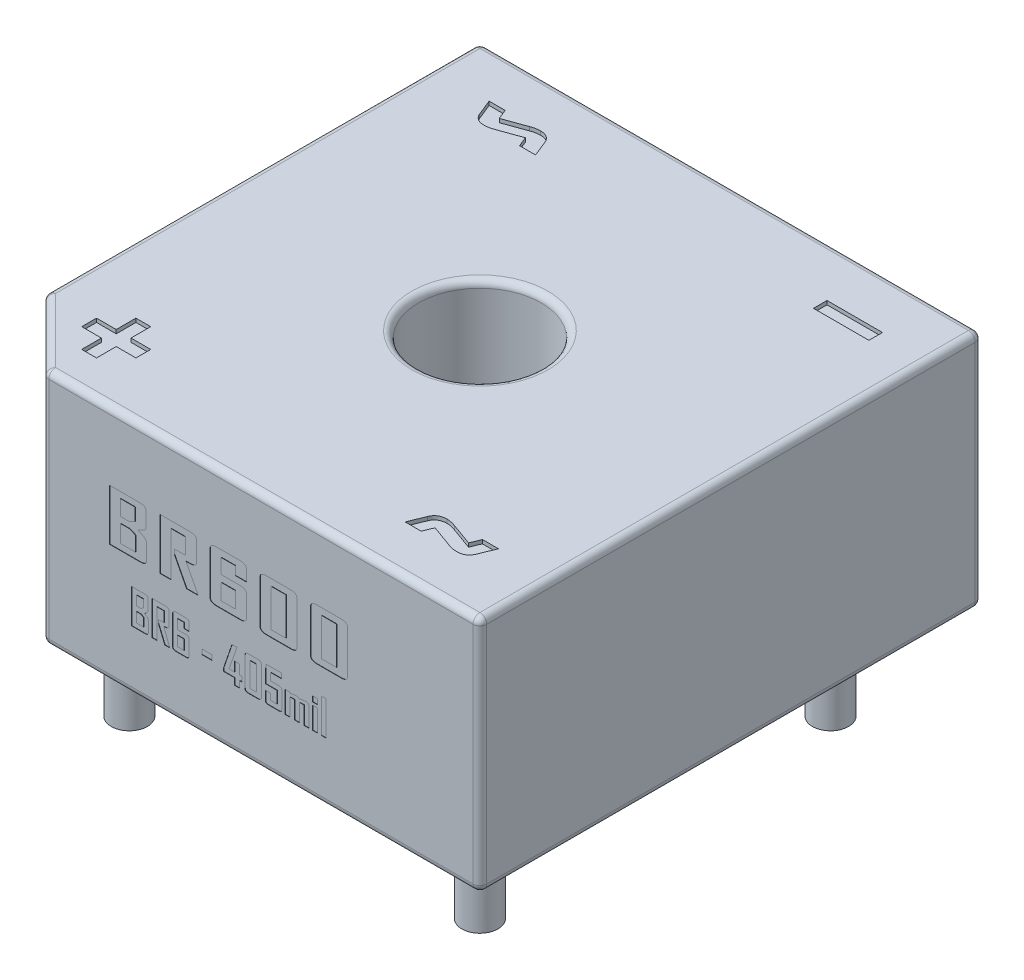
from build123d import *

# Parameters (mm, degrees)
BODY_SKETCH_W          = 14.732
BODY_SKETCH_H          = 14.732
BODY_SKETCH_R          = 1.8
BODY_MAIN_DEPTH        = 7
BODY_CHAMFER_SIZE      = 2
SKETCH24_R             = 2.3
BODY_CUT_DEPTH         = 2
BODY_REVOLVE_CUT_REACH = 22.574
BODY_FILLET_R          = 0.2
PIN_B1_SKETCH_R        = 0.53
CIRPATTERN1_COUNT      = 4
TEXT_START             = 2.2125
TEXT_2_OUTLINE_W       = 0.192771085
TEXT_2_OUTLINE_H       = 0.710843374
TEXT_2_OUTLINE_W_2     = 0.192771084
TEXT_2_OUTLINE_H_2     = 0.289156627
TEXT_2_OUTLINE_W_3     = 0.43373494
TEXT_2_OUTLINE_H_3     = 1.102409638
TEXT_2_OUTLINE_W_4     = 0.41566265
TEXT_2_OUTLINE_H_4     = 0.469879518
TEXT_2_OUTLINE_W_5     = 0.144578314
TEXT_2_OUTLINE_H_5     = 1
TEXT_2_OUTLINE_H_6     = 0.638554217
TEXT_2_OUTLINE_W_6     = 0.147213856
TEXT_2_OUTLINE_H_7     = 0.156626506
TEXT_2_OUTLINE_W_7     = 0.301204819
TEXT_2_OUTLINE_H_8     = 0.144578314
TEXT_2_DEPTH           = 0.01
SKETCH23_W             = 1.626506024
SKETCH23_H             = 0.397590361
TEXT1_DEPTH            = 0.11
PIN1_MARK_DEPTH        = 0.04


# Read off the part's stored shape, not the designer's step: text
with BuildPart() as part:
    # BODY_Sketch → BODY_MAIN (new body)
    with BuildSketch(Plane(origin=(0, 0.1, 0), x_dir=(1, 0, 0), z_dir=(0, 1, 0))):
        with Locations((5.1435, 5.1435)):
            Rectangle(BODY_SKETCH_W, BODY_SKETCH_H)
        with Locations(Location((5.1435, 5.1435, 0), (0, 0, 270))):
            Circle(BODY_SKETCH_R, mode=Mode.SUBTRACT)
    extrude(amount=BODY_MAIN_DEPTH)

    # BODY_Chamfer
    body_chamfer_edges = [part.edges().sort_by_distance(p)[0] for p in [
        (-2.2225, 3.6, 2.2225),
    ]]
    chamfer(body_chamfer_edges, length=BODY_CHAMFER_SIZE)

    # Sketch24 → BODY_Cut (cut)
    with BuildSketch(Plane(origin=(0, 0.1, 0), x_dir=(1, 0, 0), z_dir=(0, 1, 0))):
        Polygon((0.191713562, -1.2225), (11.5095, -1.2225), (11.5095, 11.5095), (-1.2225, 11.5095), (-1.2225, 0.191713562), align=None)
        with Locations(Location((5.1435, 5.1435, 0), (0, 0, 270))):
            Circle(SKETCH24_R, mode=Mode.SUBTRACT)
    extrude(amount=BODY_CUT_DEPTH, mode=Mode.SUBTRACT)

    # Sketch26 → BODY_Revolve (revolve)
    with BuildSketch(Plane(origin=(0, 0, 0), x_dir=(0, -1, 0), z_dir=(0.7071067811865461, 0, 0.707106781186549)), mode=Mode.PRIVATE) as body_revolve_sk:
        with BuildLine():
            Line((-0.4, 16.276890996), (-2.3, 16.276890996))
            Line((-2.3, 16.276890996), (-2.3, 9.574007458))
            Line((-2.3, 9.574007458), (-0.4, 9.574007458))
            add(Edge.make_bspline(
                [(-0.4, 16.276890996), (-0.4, 15.845624491), (-0.844458704, 12.99011115), (-3.607181086, 10.231780015), (-0.4, 9.574007458)],
                knots=[0, 0, 0, 0, 0.210970547, 1, 1, 1, 1], degree=3))
        make_face()
    revolve(body_revolve_sk.sketch.rotate(Axis((5.1435, 11.249169558, -5.1435), (0, -1, 0)), 135), axis=Axis((5.1435, 11.249169558, -5.1435), (0, -1, 0)))

    # Sketch28 → BODY_Revolve_Cut (cut, up to next)
    with BuildSketch(Plane(origin=(0, 2.3, 0), x_dir=(1, 0, 0), z_dir=(0, 1, 0)), mode=Mode.PRIVATE) as body_revolve_cut_sk1:
        with BuildLine():
            Line((-2.2225, -0.032787859), (-2.2225, 10.319787859))
            ThreePointArc((-2.2225, 10.319787859), (-3.859383538, 5.1435), (-2.2225, -0.032787859))
        make_face()
    body_revolve_cut_tool1 = extrude(body_revolve_cut_sk1.sketch, amount=-BODY_REVOLVE_CUT_REACH, mode=Mode.PRIVATE) & part.part
    # Sketch28 → BODY_Revolve_Cut (cut, up to next)
    with BuildSketch(Plane(origin=(0, 2.3, 0), x_dir=(1, 0, 0), z_dir=(0, 1, 0)), mode=Mode.PRIVATE) as body_revolve_cut_sk2:
        with BuildLine():
            Line((12.5095, 10.319787859), (12.5095, -0.032787859))
            ThreePointArc((12.5095, -0.032787859), (14.146383538, 5.1435), (12.5095, 10.319787859))
        make_face()
    body_revolve_cut_tool2 = extrude(body_revolve_cut_sk2.sketch, amount=-BODY_REVOLVE_CUT_REACH, mode=Mode.PRIVATE) & part.part
    # Sketch28 → BODY_Revolve_Cut (cut, up to next)
    with BuildSketch(Plane(origin=(0, 2.3, 0), x_dir=(1, 0, 0), z_dir=(0, 1, 0)), mode=Mode.PRIVATE) as body_revolve_cut_sk3:
        with BuildLine():
            Line((10.319787859, -2.2225), (-0.032787859, -2.2225))
            ThreePointArc((-0.032787859, -2.2225), (5.1435, -3.859383538), (10.319787859, -2.2225))
        make_face()
    body_revolve_cut_tool3 = extrude(body_revolve_cut_sk3.sketch, amount=-BODY_REVOLVE_CUT_REACH, mode=Mode.PRIVATE) & part.part
    # Sketch28 → BODY_Revolve_Cut (cut, up to next)
    with BuildSketch(Plane(origin=(0, 2.3, 0), x_dir=(1, 0, 0), z_dir=(0, 1, 0)), mode=Mode.PRIVATE) as body_revolve_cut_sk4:
        with BuildLine():
            ThreePointArc((10.319787859, 12.5095), (5.1435, 14.146383538), (-0.032787859, 12.5095))
            Line((-0.032787859, 12.5095), (10.319787859, 12.5095))
        make_face()
    body_revolve_cut_tool4 = extrude(body_revolve_cut_sk4.sketch, amount=-BODY_REVOLVE_CUT_REACH, mode=Mode.PRIVATE) & part.part
    add(body_revolve_cut_tool1.solids().sort_by_distance((-2.882639, 2.3, -5.1435))[0], mode=Mode.SUBTRACT)
    add(body_revolve_cut_tool2.solids().sort_by_distance((13.169639, 2.3, -5.1435))[0], mode=Mode.SUBTRACT)
    add(body_revolve_cut_tool3.solids().sort_by_distance((5.1435, 2.3, 2.882639))[0], mode=Mode.SUBTRACT)
    add(body_revolve_cut_tool4.solids().sort_by_distance((5.1435, 2.3, -13.169639))[0], mode=Mode.SUBTRACT)

    # BODY_Fillet
    body_fillet_edges = [part.edges().sort_by_distance(p)[0] for p in [
        (5.1435, 7.1, -6.9435),
        (12.5095, 7.1, -5.1435),
        (5.1435, 7.1, -12.5095),
        (6.1435, 0.1, 2.2225),
        (6.1435, 7.1, 2.2225),
        (-0.2225, 3.6, 2.2225),
        (-1.2225, 0.1, 1.2225),
        (-2.2225, 3.6, 0.2225),
        (-1.2225, 7.1, 1.2225),
        (-2.2225, 7.1, -6.1435),
        (5.1435, 0.1, -12.5095),
        (12.5095, 0.1, -5.1435),
        (-2.2225, 0.1, -6.1435),
        (-2.2225, 3.6, -12.5095),
        (12.5095, 3.6, -12.5095),
        (12.5095, 3.6, 2.2225),
    ]]
    fillet(body_fillet_edges, radius=BODY_FILLET_R)

    # PIN_Sweep: sweep along a path in PIN_B1_Path
    with BuildLine(Plane(origin=(0, 0, 0), x_dir=(0, 0, -1), z_dir=(1, 0, 0))) as pin_sweep_path:
        Line((0, -2.7), (0, 0))
        Line((0, 0), (0, 3.6))
    # PIN_B1_Sketch → PIN_Sweep (sweep)
    with BuildSketch(Plane(origin=(0, 0, 0), x_dir=(1, 0, 0), z_dir=(0, 1, 0))):
        Circle(PIN_B1_SKETCH_R)
    pin_sweep = sweep(path=pin_sweep_path.line)

    # CirPattern1: PIN_Sweep ×4 about axis
    cirpattern1_axis = Axis((5.1435, 0, -5.1435), (0, 1, 0))
    for i in range(1, CIRPATTERN1_COUNT):
        add(pin_sweep.rotate(cirpattern1_axis, i * 360 / CIRPATTERN1_COUNT))

    # text 2 outline → text 2 (cut)
    # profile 1 of 16: a face of its own
    with BuildSketch(Plane.XY.offset(TEXT_START)):
        with BuildLine():
            add(Edge.make_bspline(
                [(2.72723494, 3.718317018), (2.726470148, 3.709278365), (2.725003278, 3.691942231), (2.715388648, 3.667990262), (2.701081403, 3.647239819), (2.680680404, 3.630744985), (2.655657104, 3.617265222), (2.625226844, 3.60805875), (2.589862782, 3.601839387), (2.564520572, 3.600639002), (2.55103012, 3.6)],
                knots=[0, 0, 0, 0, 0.114098337, 0.218840581, 0.322174175, 0.429434412, 0.547100708, 0.679564678, 0.829422238, 1, 1, 1, 1], degree=3))
            Line((2.72723494, 3.718317018), (2.72723494, 4.155440512))
            add(Edge.make_bspline(
                [(2.652404367, 4.292394578), (2.658354922, 4.288208998), (2.670030613, 4.279996395), (2.68518465, 4.265533806), (2.698190252, 4.250008652), (2.708884691, 4.233448906), (2.717356401, 4.215645952), (2.722740452, 4.19652504), (2.726727845, 4.176406256), (2.727063684, 4.162521049), (2.72723494, 4.155440512)],
                knots=[0, 0, 0, 0, 0.133657493, 0.26225178, 0.383948145, 0.505447312, 0.623949121, 0.745003415, 0.869968602, 1, 1, 1, 1], degree=3))
            add(Edge.make_bspline(
                [(2.477329066, 4.377108434), (2.490323612, 4.371000971), (2.514635185, 4.359574485), (2.548588493, 4.343423057), (2.577662056, 4.329562103), (2.602028401, 4.318060985), (2.621469501, 4.308458496), (2.63611909, 4.301058465), (2.646046071, 4.296218917), (2.650813002, 4.293351741), (2.652404367, 4.292394578)],
                knots=[0, 0, 0, 0, 0.221438922, 0.414291367, 0.579869792, 0.718174277, 0.829838972, 0.91423528, 0.971368777, 1, 1, 1, 1], degree=3))
            add(Edge.make_bspline(
                [(2.646474398, 4.458433735), (2.644882566, 4.457477586), (2.6402947, 4.454721841), (2.630820988, 4.45001016), (2.616568319, 4.443328397), (2.597946785, 4.433865854), (2.574187222, 4.42304747), (2.546192819, 4.409368019), (2.513337628, 4.39384559), (2.489854385, 4.382930333), (2.477329066, 4.377108434)],
                knots=[0, 0, 0, 0, 0.029670315, 0.085513729, 0.168947239, 0.28130074, 0.41925825, 0.586125272, 0.779250554, 1, 1, 1, 1], degree=3))
            add(Edge.make_bspline(
                [(2.715939759, 4.589175452), (2.715703402, 4.582295185), (2.715244348, 4.568932312), (2.7122336, 4.5494097), (2.706420349, 4.531271222), (2.698783838, 4.51419458), (2.689107271, 4.498185101), (2.677179937, 4.483429042), (2.662877863, 4.469996723), (2.652034082, 4.46235282), (2.646474398, 4.458433735)],
                knots=[0, 0, 0, 0, 0.133406508, 0.259102454, 0.381455931, 0.501515548, 0.621060989, 0.743032877, 0.868251092, 1, 1, 1, 1], degree=3))
            Line((2.715939759, 4.589175452), (2.715939759, 4.981682982))
            add(Edge.make_bspline(
                [(2.54538253, 5.1), (2.558404061, 5.099360983), (2.582907274, 5.098158516), (2.617135866, 5.09190675), (2.646670764, 5.082759111), (2.670874939, 5.069164858), (2.690697134, 5.05273941), (2.704366518, 5.031895781), (2.71365419, 5.008010235), (2.715155488, 4.990716923), (2.715939759, 4.981682982)],
                knots=[0, 0, 0, 0, 0.168128508, 0.316375143, 0.448176834, 0.565139626, 0.672821552, 0.776962353, 0.883486227, 1, 1, 1, 1], degree=3))
            Line((2.54538253, 5.1), (1.64289759, 5.1))
            Line((1.64289759, 5.1), (1.64289759, 3.6))
            Line((1.64289759, 3.6), (2.55103012, 3.6))
        make_face()
        Polygon((1.968198795, 3.780722892), (1.968198795, 4.286746988), (2.235894578, 4.286746988), (2.401933735, 4.213045934), (2.401933735, 3.780722892), align=None, mode=Mode.SUBTRACT)
        Polygon((2.390638554, 4.546253765), (2.230246988, 4.46746988), (1.968198795, 4.46746988), (1.968198795, 4.919277108), (2.390638554, 4.919277108), align=None, mode=Mode.SUBTRACT)
    # profile 2 of 16: a face of its own
    with BuildSketch(Plane.XY.offset(TEXT_START)):
        with BuildLine():
            add(Edge.make_bspline(
                [(6.938680723, 2.455421687), (6.954682956, 2.458932438), (6.986627561, 2.465940808), (7.018563473, 2.472988688), (7.034501506, 2.476506024)],
                knots=[0, 0, 0, 0, 0.500936953, 1, 1, 1, 1], degree=3))
            Line((6.938680723, 2.455421687), (6.938680723, 2.488554217))
            Line((6.938680723, 2.488554217), (6.79410241, 2.488554217))
            Line((6.79410241, 2.488554217), (6.79410241, 1.85))
            Line((6.79410241, 1.85), (6.938680723, 1.85))
            Line((6.938680723, 1.85), (6.938680723, 2.366566265))
            Line((6.938680723, 2.366566265), (7.071210843, 2.368072289))
            Line((7.071210843, 2.368072289), (7.071210843, 1.85))
            Line((7.071210843, 1.85), (7.215789157, 1.85))
            Line((7.215789157, 1.85), (7.215789157, 2.366566265))
            Line((7.215789157, 2.366566265), (7.348319277, 2.368072289))
            Line((7.348319277, 2.368072289), (7.348319277, 1.85))
            Line((7.348319277, 1.85), (7.49289759, 1.85))
            Line((7.49289759, 1.85), (7.49289759, 2.409676205))
            add(Edge.make_bspline(
                [(7.408560241, 2.488554217), (7.415044869, 2.488253553), (7.427330408, 2.487683926), (7.444515429, 2.483781632), (7.459168508, 2.477318334), (7.471370506, 2.468570007), (7.480956268, 2.457203183), (7.487703468, 2.443369843), (7.491845126, 2.427224643), (7.492534742, 2.415726215), (7.49289759, 2.409676205)],
                knots=[0, 0, 0, 0, 0.148290832, 0.280946377, 0.400455298, 0.512425211, 0.621411208, 0.736958176, 0.861597969, 1, 1, 1, 1], degree=3))
            add(Edge.make_bspline(
                [(7.304832831, 2.474246988), (7.315424593, 2.476389603), (7.335299693, 2.48041015), (7.363228016, 2.48496172), (7.387229596, 2.487819783), (7.401902803, 2.488324995), (7.408560241, 2.488554217)],
                knots=[0, 0, 0, 0, 0.309141697, 0.580094407, 0.809483008, 1, 1, 1, 1], degree=3))
            add(Edge.make_bspline(
                [(7.202423193, 2.452786145), (7.219497755, 2.45627019), (7.2536721, 2.463243426), (7.287770866, 2.47057733), (7.304832831, 2.474246988)],
                knots=[0, 0, 0, 0, 0.499630991, 1, 1, 1, 1], degree=3))
            add(Edge.make_bspline(
                [(7.131451807, 2.488554217), (7.135851093, 2.488459163), (7.144246265, 2.488277772), (7.156236574, 2.486549379), (7.167029587, 2.483828311), (7.176537454, 2.479777842), (7.185069157, 2.474920693), (7.192169978, 2.468630731), (7.198313113, 2.461367551), (7.201035395, 2.455683717), (7.202423193, 2.452786145)],
                knots=[0, 0, 0, 0, 0.156270314, 0.29821119, 0.429671568, 0.550627586, 0.664617534, 0.776870433, 0.88625033, 1, 1, 1, 1], degree=3))
            add(Edge.make_bspline(
                [(7.034501506, 2.476506024), (7.043774214, 2.478346616), (7.061509319, 2.481866955), (7.087017071, 2.485578016), (7.110068148, 2.4880487), (7.124606651, 2.488392395), (7.131451807, 2.488554217)],
                knots=[0, 0, 0, 0, 0.289803378, 0.554281819, 0.790142707, 1, 1, 1, 1], degree=3))
        make_face()
    # profile 3 of 16: a face of its own
    with BuildSketch(Plane.XY.offset(TEXT_START)):
        with BuildLine():
            add(Edge.make_bspline(
                [(6.697716867, 1.928878012), (6.69729157, 1.922885605), (6.696488279, 1.911567306), (6.692226108, 1.895788213), (6.685972183, 1.882065602), (6.676752164, 1.870964704), (6.665651266, 1.861744684), (6.651928655, 1.855490759), (6.636149562, 1.851228589), (6.624831263, 1.850425298), (6.618838855, 1.85)],
                knots=[0, 0, 0, 0, 0.143087679, 0.270260174, 0.38817721, 0.5, 0.61182279, 0.729739826, 0.856912321, 1, 1, 1, 1], degree=3))
            Line((6.697716867, 1.928878012), (6.697716867, 2.409676205))
            add(Edge.make_bspline(
                [(6.618838855, 2.488554217), (6.624831263, 2.488128919), (6.636149562, 2.487325628), (6.651928655, 2.483063458), (6.665651266, 2.476809533), (6.676752164, 2.467589513), (6.685972183, 2.456488615), (6.692226108, 2.442766004), (6.696488279, 2.426986911), (6.69729157, 2.415668612), (6.697716867, 2.409676205)],
                knots=[0, 0, 0, 0, 0.143087679, 0.270260174, 0.38817721, 0.5, 0.61182279, 0.729739826, 0.856912321, 1, 1, 1, 1], degree=3))
            Line((6.618838855, 2.488554217), (6.36036747, 2.488554217))
            Line((6.36036747, 2.488554217), (6.372415663, 2.705421687))
            Line((6.372415663, 2.705421687), (6.685668675, 2.705421687))
            Line((6.685668675, 2.705421687), (6.685668675, 2.85))
            Line((6.685668675, 2.85), (6.227837349, 2.85))
            Line((6.227837349, 2.85), (6.215789157, 2.343975904))
            Line((6.215789157, 2.343975904), (6.553138554, 2.343975904))
            Line((6.553138554, 2.343975904), (6.553138554, 1.994578313))
            Line((6.553138554, 1.994578313), (6.36036747, 1.994578313))
            Line((6.36036747, 1.994578313), (6.36036747, 2.175301205))
            Line((6.36036747, 2.175301205), (6.215789157, 2.175301205))
            Line((6.215789157, 2.175301205), (6.215789157, 1.928878012))
            add(Edge.make_bspline(
                [(6.294667169, 1.85), (6.288674761, 1.850425298), (6.277356463, 1.851228589), (6.261577369, 1.855490759), (6.247854758, 1.861744684), (6.23675386, 1.870964704), (6.227533841, 1.882065602), (6.221279916, 1.895788213), (6.217017746, 1.911567306), (6.216214454, 1.922885605), (6.215789157, 1.928878012)],
                knots=[0, 0, 0, 0, 0.143087679, 0.270260174, 0.38817721, 0.5, 0.61182279, 0.729739826, 0.856912321, 1, 1, 1, 1], degree=3))
            Line((6.294667169, 1.85), (6.618838855, 1.85))
        make_face()
    # profile 4 of 16: a face of its own
    with BuildSketch(Plane.XY.offset(TEXT_START)):
        with BuildLine():
            add(Edge.make_bspline(
                [(6.095307229, 1.928878012), (6.094881931, 1.922885605), (6.09407864, 1.911567306), (6.08981647, 1.895788213), (6.083562545, 1.882065602), (6.074342525, 1.870964704), (6.063241627, 1.861744684), (6.049519016, 1.855490759), (6.033739923, 1.851228589), (6.022421624, 1.850425298), (6.016429217, 1.85)],
                knots=[0, 0, 0, 0, 0.143087679, 0.270260174, 0.38817721, 0.5, 0.61182279, 0.729739826, 0.856912321, 1, 1, 1, 1], degree=3))
            Line((6.095307229, 1.928878012), (6.095307229, 2.771121988))
            add(Edge.make_bspline(
                [(6.016429217, 2.85), (6.022421624, 2.849574702), (6.033739923, 2.848771411), (6.049519016, 2.844509241), (6.063241627, 2.838255316), (6.074342525, 2.829035296), (6.083562545, 2.817934398), (6.08981647, 2.804211787), (6.09407864, 2.788432694), (6.094881931, 2.777114395), (6.095307229, 2.771121988)],
                knots=[0, 0, 0, 0, 0.143087679, 0.270260174, 0.38817721, 0.5, 0.61182279, 0.729739826, 0.856912321, 1, 1, 1, 1], degree=3))
            Line((6.016429217, 2.85), (5.694328313, 2.85))
            add(Edge.make_bspline(
                [(5.613379518, 2.771121988), (5.613787826, 2.777117466), (5.614560159, 2.788458173), (5.619054479, 2.804240236), (5.625534839, 2.817876024), (5.63472964, 2.829169706), (5.646243825, 2.838241146), (5.660356017, 2.844549964), (5.676593339, 2.848741356), (5.688213631, 2.849566044), (5.694328313, 2.85)],
                knots=[0, 0, 0, 0, 0.141191735, 0.267070268, 0.384070853, 0.494411966, 0.607065164, 0.726092805, 0.855868051, 1, 1, 1, 1], degree=3))
            Line((5.613379518, 2.771121988), (5.613379518, 1.928878012))
            add(Edge.make_bspline(
                [(5.69225753, 1.85), (5.686265123, 1.850425298), (5.674946824, 1.851228589), (5.659167731, 1.855490759), (5.64544512, 1.861744684), (5.634344222, 1.870964704), (5.625124202, 1.882065602), (5.618870277, 1.895788213), (5.614608107, 1.911567306), (5.613804816, 1.922885605), (5.613379518, 1.928878012)],
                knots=[0, 0, 0, 0, 0.143087679, 0.270260174, 0.38817721, 0.5, 0.61182279, 0.729739826, 0.856912321, 1, 1, 1, 1], degree=3))
            Line((5.69225753, 1.85), (6.016429217, 1.85))
        make_face()
        with Locations((5.854343374, 2.35)):
            Rectangle(TEXT_2_OUTLINE_W, TEXT_2_OUTLINE_H, mode=Mode.SUBTRACT)
    # profile 5 of 16: a face of its own
    with BuildSketch(Plane.XY.offset(TEXT_START)):
        with BuildLine():
            add(Edge.make_bspline(
                [(3.974825301, 1.928878012), (3.974400003, 1.922885605), (3.973596712, 1.911567306), (3.969334542, 1.895788213), (3.963080617, 1.882065602), (3.953860597, 1.870964704), (3.942759699, 1.861744684), (3.929037088, 1.855490759), (3.913257995, 1.851228589), (3.901939697, 1.850425298), (3.895947289, 1.85)],
                knots=[0, 0, 0, 0, 0.143087679, 0.270260174, 0.38817721, 0.5, 0.61182279, 0.729739826, 0.856912321, 1, 1, 1, 1], degree=3))
            Line((3.974825301, 1.928878012), (3.974825301, 2.349435241))
            add(Edge.make_bspline(
                [(3.895947289, 2.428313253), (3.901939697, 2.427887955), (3.913257995, 2.427084664), (3.929037088, 2.422822494), (3.942759699, 2.416568569), (3.953860597, 2.407348549), (3.963080617, 2.396247651), (3.969334542, 2.38252504), (3.973596712, 2.366745947), (3.974400003, 2.355427648), (3.974825301, 2.349435241)],
                knots=[0, 0, 0, 0, 0.143087679, 0.270260174, 0.38817721, 0.5, 0.61182279, 0.729739826, 0.856912321, 1, 1, 1, 1], degree=3))
            Line((3.895947289, 2.428313253), (3.637475904, 2.428313253))
            Line((3.637475904, 2.428313253), (3.637475904, 2.705421687))
            Line((3.637475904, 2.705421687), (3.830246988, 2.705421687))
            Line((3.830246988, 2.705421687), (3.830246988, 2.548795181))
            Line((3.830246988, 2.548795181), (3.974825301, 2.548795181))
            Line((3.974825301, 2.548795181), (3.974825301, 2.771121988))
            add(Edge.make_bspline(
                [(3.893311747, 2.85), (3.899489257, 2.849569837), (3.911172777, 2.84875627), (3.927477339, 2.844557953), (3.941613102, 2.838192738), (3.953265605, 2.829177078), (3.962687284, 2.817937658), (3.96914019, 2.804232735), (3.973647648, 2.788460381), (3.974418026, 2.77711823), (3.974825301, 2.771121988)],
                knots=[0, 0, 0, 0, 0.14508376, 0.274396833, 0.393000578, 0.506415645, 0.617296951, 0.733880858, 0.859311096, 1, 1, 1, 1], degree=3))
            Line((3.893311747, 2.85), (3.569704819, 2.85))
            add(Edge.make_bspline(
                [(3.49289759, 2.771121988), (3.493348966, 2.777106232), (3.494200315, 2.788393224), (3.498124708, 2.804260607), (3.504515295, 2.817795432), (3.513252881, 2.829104043), (3.524148548, 2.838122121), (3.537433708, 2.844610416), (3.552845785, 2.84871596), (3.563905337, 2.849558292), (3.569704819, 2.85)],
                knots=[0, 0, 0, 0, 0.145024035, 0.273532474, 0.39304524, 0.504494616, 0.616655213, 0.732076914, 0.859504673, 1, 1, 1, 1], degree=3))
            Line((3.49289759, 2.771121988), (3.49289759, 1.928878012))
            add(Edge.make_bspline(
                [(3.571775602, 1.85), (3.565783667, 1.850567806), (3.554462496, 1.851640621), (3.538658886, 1.856034116), (3.525008793, 1.862525221), (3.513851385, 1.871703675), (3.504699139, 1.882787269), (3.498377727, 1.896339181), (3.494145716, 1.911882523), (3.493328372, 1.923012136), (3.49289759, 1.928878012)],
                knots=[0, 0, 0, 0, 0.144063064, 0.272192968, 0.391286138, 0.503600729, 0.615915321, 0.732995828, 0.859275126, 1, 1, 1, 1], degree=3))
            Line((3.571775602, 1.85), (3.895947289, 1.85))
        make_face()
        with Locations((3.733861446, 2.139156627)):
            Rectangle(TEXT_2_OUTLINE_W_2, TEXT_2_OUTLINE_H_2, mode=Mode.SUBTRACT)
    # profile 6 of 16: a face of its own
    with BuildSketch(Plane.XY.offset(TEXT_START)):
        with BuildLine():
            add(Edge.make_bspline(
                [(3.305585843, 2.85), (3.311763003, 2.849568328), (3.323445861, 2.848751906), (3.339699521, 2.844586876), (3.353682307, 2.838236219), (3.365004647, 2.829157024), (3.374007081, 2.817893549), (3.380189968, 2.804253025), (3.383737918, 2.788368198), (3.384212111, 2.777102717), (3.384463855, 2.771121988)],
                knots=[0, 0, 0, 0, 0.14634727, 0.276786508, 0.395078095, 0.5071419, 0.617118303, 0.733434305, 0.858482998, 1, 1, 1, 1], degree=3))
            Line((3.305585843, 2.85), (2.890487952, 2.85))
            Line((2.890487952, 2.85), (2.890487952, 1.85))
            Line((2.890487952, 1.85), (3.035066265, 1.85))
            Line((3.035066265, 1.85), (3.035066265, 2.705421687))
            Line((3.035066265, 2.705421687), (3.239885542, 2.705421687))
            Line((3.239885542, 2.705421687), (3.239885542, 2.404216867))
            Line((3.239885542, 2.404216867), (3.071210843, 2.404216867))
            Line((3.071210843, 2.404216867), (3.071210843, 2.314231928))
            Line((3.071210843, 2.314231928), (3.263981928, 1.85))
            Line((3.263981928, 1.85), (3.408560241, 1.85))
            Line((3.408560241, 1.85), (3.235179217, 2.307831325))
            add(Edge.make_bspline(
                [(3.338718373, 2.316114458), (3.336404923, 2.315452137), (3.331262268, 2.313979838), (3.322560671, 2.312399801), (3.312150663, 2.310831183), (3.300009079, 2.309849741), (3.286210026, 2.308823455), (3.270698284, 2.308361137), (3.253504548, 2.307964225), (3.241454647, 2.307876836), (3.235179217, 2.307831325)],
                knots=[0, 0, 0, 0, 0.069269872, 0.153982571, 0.254430838, 0.37240564, 0.504648634, 0.652947489, 0.819259615, 1, 1, 1, 1], degree=3))
            add(Edge.make_bspline(
                [(3.384463855, 2.386709337), (3.384315194, 2.382559037), (3.384029384, 2.374579879), (3.381958449, 2.363089461), (3.37837343, 2.352594265), (3.373261785, 2.343131654), (3.366729154, 2.334656203), (3.358758658, 2.327313383), (3.349357065, 2.32096746), (3.342349019, 2.317770633), (3.338718373, 2.316114458)],
                knots=[0, 0, 0, 0, 0.138433635, 0.26614554, 0.387972954, 0.506942436, 0.623360746, 0.743357427, 0.867041637, 1, 1, 1, 1], degree=3))
            Line((3.384463855, 2.386709337), (3.384463855, 2.771121988))
        make_face()
    # profile 7 of 16: a face of its own
    with BuildSketch(Plane.XY.offset(TEXT_START)):
        with BuildLine():
            add(Edge.make_bspline(
                [(2.782054217, 1.928878012), (2.781628919, 1.922885605), (2.780825628, 1.911567306), (2.776563458, 1.895788213), (2.770309533, 1.882065602), (2.761089513, 1.870964704), (2.749988615, 1.861744684), (2.736266004, 1.855490759), (2.720486911, 1.851228589), (2.709168612, 1.850425298), (2.703176205, 1.85)],
                knots=[0, 0, 0, 0, 0.143087679, 0.270260174, 0.38817721, 0.5, 0.61182279, 0.729739826, 0.856912321, 1, 1, 1, 1], degree=3))
            Line((2.782054217, 1.928878012), (2.782054217, 2.208245482))
            add(Edge.make_bspline(
                [(2.748733434, 2.299548193), (2.753848541, 2.293658419), (2.764172442, 2.281770995), (2.77468981, 2.259859827), (2.78102898, 2.235022305), (2.781701833, 2.217448922), (2.782054217, 2.208245482)],
                knots=[0, 0, 0, 0, 0.233880582, 0.472044868, 0.723502121, 1, 1, 1, 1], degree=3))
            add(Edge.make_bspline(
                [(2.671173193, 2.356024096), (2.676948675, 2.35194868), (2.687760505, 2.34431941), (2.702834542, 2.333607842), (2.715647018, 2.32431161), (2.726450083, 2.316631347), (2.73505829, 2.310219876), (2.741606635, 2.305361372), (2.746026541, 2.302070977), (2.748050671, 2.300184517), (2.748733434, 2.299548193)],
                knots=[0, 0, 0, 0, 0.220969595, 0.413659948, 0.578075155, 0.71580951, 0.828017936, 0.913546243, 0.970838158, 1, 1, 1, 1], degree=3))
            add(Edge.make_bspline(
                [(2.746286145, 2.410240964), (2.745606635, 2.409600396), (2.743619822, 2.407727444), (2.739233301, 2.404745561), (2.732937242, 2.400140383), (2.724800346, 2.393824153), (2.714079378, 2.386718835), (2.701786255, 2.377448222), (2.687092309, 2.367283934), (2.676688012, 2.359924814), (2.671173193, 2.356024096)],
                knots=[0, 0, 0, 0, 0.030202642, 0.08830924, 0.171209504, 0.28295023, 0.421594497, 0.587395026, 0.781297856, 1, 1, 1, 1], degree=3))
            add(Edge.make_bspline(
                [(2.776971386, 2.497402108), (2.776679047, 2.488510421), (2.776122368, 2.471578628), (2.770054767, 2.447821691), (2.760729805, 2.426824722), (2.751034397, 2.415692759), (2.746286145, 2.410240964)],
                knots=[0, 0, 0, 0, 0.28088772, 0.534874023, 0.772208062, 1, 1, 1, 1], degree=3))
            Line((2.776971386, 2.497402108), (2.776971386, 2.771121988))
            add(Edge.make_bspline(
                [(2.700540663, 2.85), (2.706343066, 2.849567036), (2.717347706, 2.84874589), (2.732665915, 2.844560369), (2.745896976, 2.838184364), (2.756620058, 2.829033749), (2.765361132, 2.817804639), (2.771742059, 2.804257878), (2.775669316, 2.788394033), (2.776520236, 2.777106512), (2.776971386, 2.771121988)],
                knots=[0, 0, 0, 0, 0.140866031, 0.267161677, 0.382887924, 0.494174249, 0.60591769, 0.725745796, 0.854593311, 1, 1, 1, 1], degree=3))
            Line((2.700540663, 2.85), (2.288078313, 2.85))
            Line((2.288078313, 2.85), (2.288078313, 1.85))
            Line((2.288078313, 1.85), (2.703176205, 1.85))
        make_face()
        Polygon((2.637475904, 1.994578313), (2.432656627, 1.994578313), (2.432656627, 2.28373494), (2.563115964, 2.28373494), (2.637475904, 2.241566265), align=None, mode=Mode.SUBTRACT)
        Polygon((2.432656627, 2.705421687), (2.632393072, 2.705421687), (2.632393072, 2.476694277), (2.560668675, 2.428313253), (2.432656627, 2.428313253), align=None, mode=Mode.SUBTRACT)
    # profile 8 of 16: a face of its own
    with BuildSketch(Plane.XY.offset(TEXT_START)):
        with BuildLine():
            add(Edge.make_bspline(
                [(8.62603012, 3.718317018), (8.625265329, 3.709278365), (8.623798459, 3.691942231), (8.614183829, 3.667990262), (8.599876584, 3.647239819), (8.579475585, 3.630744985), (8.554452284, 3.617265222), (8.524022024, 3.60805875), (8.488657962, 3.601839387), (8.463315753, 3.600639002), (8.449825301, 3.6)],
                knots=[0, 0, 0, 0, 0.114098337, 0.218840581, 0.322174175, 0.429434412, 0.547100708, 0.679564678, 0.829422238, 1, 1, 1, 1], degree=3))
            Line((8.62603012, 3.718317018), (8.62603012, 4.981682982))
            add(Edge.make_bspline(
                [(8.449825301, 5.1), (8.463315753, 5.099360998), (8.488657962, 5.098160613), (8.524022024, 5.09194125), (8.554452284, 5.082734778), (8.579475585, 5.069255015), (8.599876584, 5.052760181), (8.614183829, 5.032009738), (8.623798459, 5.008057769), (8.625265329, 4.990721635), (8.62603012, 4.981682982)],
                knots=[0, 0, 0, 0, 0.170577762, 0.320435322, 0.452899292, 0.570565588, 0.677825825, 0.781159419, 0.885901663, 1, 1, 1, 1], degree=3))
            Line((8.449825301, 5.1), (7.722133283, 5.1))
            add(Edge.make_bspline(
                [(7.541692771, 4.981682982), (7.542431962, 4.990731136), (7.54385257, 5.008120262), (7.553861549, 5.032024646), (7.568439629, 5.052874026), (7.58942974, 5.069244688), (7.614983513, 5.082729829), (7.646146231, 5.092009226), (7.68237153, 5.098121642), (7.708362923, 5.099349484), (7.722133283, 5.1)],
                knots=[0, 0, 0, 0, 0.112348161, 0.215915455, 0.318343111, 0.425762474, 0.543690884, 0.676356302, 0.828532073, 1, 1, 1, 1], degree=3))
            Line((7.541692771, 4.981682982), (7.541692771, 3.718317018))
            add(Edge.make_bspline(
                [(7.71789759, 3.6), (7.704407138, 3.600639002), (7.679064929, 3.601839387), (7.643700867, 3.60805875), (7.613270607, 3.617265222), (7.588247307, 3.630744985), (7.567846308, 3.647239819), (7.553539063, 3.667990262), (7.543924432, 3.691942231), (7.542457563, 3.709278365), (7.541692771, 3.718317018)],
                knots=[0, 0, 0, 0, 0.170577762, 0.320435322, 0.452899292, 0.570565588, 0.677825825, 0.781159419, 0.885901663, 1, 1, 1, 1], degree=3))
            Line((7.71789759, 3.6), (8.449825301, 3.6))
        make_face()
        with Locations((8.083861446, 4.35)):
            Rectangle(TEXT_2_OUTLINE_W_3, TEXT_2_OUTLINE_H_3, mode=Mode.SUBTRACT)
    # profile 9 of 16: a face of its own
    with BuildSketch(Plane.XY.offset(TEXT_START)):
        with BuildLine():
            add(Edge.make_bspline(
                [(7.142295181, 3.718317018), (7.141530389, 3.709278365), (7.140063519, 3.691942231), (7.130448889, 3.667990262), (7.116141644, 3.647239819), (7.095740645, 3.630744985), (7.070717345, 3.617265222), (7.040287084, 3.60805875), (7.004923023, 3.601839387), (6.979580813, 3.600639002), (6.966090361, 3.6)],
                knots=[0, 0, 0, 0, 0.114098337, 0.218840581, 0.322174175, 0.429434412, 0.547100708, 0.679564678, 0.829422238, 1, 1, 1, 1], degree=3))
            Line((7.142295181, 3.718317018), (7.142295181, 4.981682982))
            add(Edge.make_bspline(
                [(6.966090361, 5.1), (6.979580813, 5.099360998), (7.004923023, 5.098160613), (7.040287084, 5.09194125), (7.070717345, 5.082734778), (7.095740645, 5.069255015), (7.116141644, 5.052760181), (7.130448889, 5.032009738), (7.140063519, 5.008057769), (7.141530389, 4.990721635), (7.142295181, 4.981682982)],
                knots=[0, 0, 0, 0, 0.170577762, 0.320435322, 0.452899292, 0.570565588, 0.677825825, 0.781159419, 0.885901663, 1, 1, 1, 1], degree=3))
            Line((6.966090361, 5.1), (6.238398343, 5.1))
            add(Edge.make_bspline(
                [(6.057957831, 4.981682982), (6.058697022, 4.990731136), (6.06011763, 5.008120262), (6.070126609, 5.032024646), (6.084704689, 5.052874026), (6.1056948, 5.069244688), (6.131248574, 5.082729829), (6.162411291, 5.092009226), (6.19863659, 5.098121642), (6.224627983, 5.099349484), (6.238398343, 5.1)],
                knots=[0, 0, 0, 0, 0.112348161, 0.215915455, 0.318343111, 0.425762474, 0.543690884, 0.676356302, 0.828532073, 1, 1, 1, 1], degree=3))
            Line((6.057957831, 4.981682982), (6.057957831, 3.718317018))
            add(Edge.make_bspline(
                [(6.234162651, 3.6), (6.220672199, 3.600639002), (6.195329989, 3.601839387), (6.159965928, 3.60805875), (6.129535667, 3.617265222), (6.104512367, 3.630744985), (6.084111368, 3.647239819), (6.069804123, 3.667990262), (6.060189493, 3.691942231), (6.058722623, 3.709278365), (6.057957831, 3.718317018)],
                knots=[0, 0, 0, 0, 0.170577762, 0.320435322, 0.452899292, 0.570565588, 0.677825825, 0.781159419, 0.885901663, 1, 1, 1, 1], degree=3))
            Line((6.234162651, 3.6), (6.966090361, 3.6))
        make_face()
        with Locations((6.600126506, 4.35)):
            Rectangle(TEXT_2_OUTLINE_W_3, TEXT_2_OUTLINE_H_3, mode=Mode.SUBTRACT)
    # profile 10 of 16: a face of its own
    with BuildSketch(Plane.XY.offset(TEXT_START)):
        with BuildLine():
            add(Edge.make_bspline(
                [(5.658560241, 3.718317018), (5.657795449, 3.709278365), (5.65632858, 3.691942231), (5.646713949, 3.667990262), (5.632406704, 3.647239819), (5.612005706, 3.630744985), (5.586982405, 3.617265222), (5.556552145, 3.60805875), (5.521188083, 3.601839387), (5.495845874, 3.600639002), (5.482355422, 3.6)],
                knots=[0, 0, 0, 0, 0.114098337, 0.218840581, 0.322174175, 0.429434412, 0.547100708, 0.679564678, 0.829422238, 1, 1, 1, 1], degree=3))
            Line((5.658560241, 3.718317018), (5.658560241, 4.349152861))
            add(Edge.make_bspline(
                [(5.482355422, 4.46746988), (5.495845874, 4.466830877), (5.521188083, 4.465630492), (5.556552145, 4.45941113), (5.586982405, 4.450204658), (5.612005706, 4.436724894), (5.632406704, 4.42023006), (5.646713949, 4.399479618), (5.65632858, 4.375527648), (5.657795449, 4.358191514), (5.658560241, 4.349152861)],
                knots=[0, 0, 0, 0, 0.170577762, 0.320435322, 0.452899292, 0.570565588, 0.677825825, 0.781159419, 0.885901663, 1, 1, 1, 1], degree=3))
            Line((5.482355422, 4.46746988), (4.917596386, 4.46746988))
            Line((4.917596386, 4.46746988), (4.917596386, 4.901204819))
            Line((4.917596386, 4.901204819), (5.333259036, 4.901204819))
            Line((5.333259036, 4.901204819), (5.333259036, 4.648192771))
            Line((5.333259036, 4.648192771), (5.658560241, 4.648192771))
            Line((5.658560241, 4.648192771), (5.658560241, 4.981682982))
            add(Edge.make_bspline(
                [(5.476707831, 5.1), (5.490571423, 5.099348471), (5.516748221, 5.098118275), (5.553261261, 5.092012453), (5.584673182, 5.082706657), (5.610522365, 5.06934575), (5.631467001, 5.052767369), (5.646520598, 5.032191037), (5.655951625, 5.008014635), (5.657665855, 4.990711014), (5.658560241, 4.981682982)],
                knots=[0, 0, 0, 0, 0.171795037, 0.324377983, 0.457509088, 0.575894714, 0.682790249, 0.78540302, 0.888035662, 1, 1, 1, 1], degree=3))
            Line((5.476707831, 5.1), (4.764264307, 5.1))
            add(Edge.make_bspline(
                [(4.592295181, 4.981682982), (4.593086058, 4.990712269), (4.594600002, 5.00799667), (4.603818968, 5.031994374), (4.617859289, 5.052645075), (4.637665672, 5.069264452), (4.662159678, 5.082737268), (4.691945496, 5.091910157), (4.726461047, 5.098154923), (4.751149534, 5.099359903), (4.764264307, 5.1)],
                knots=[0, 0, 0, 0, 0.115898454, 0.221859767, 0.326132372, 0.433245621, 0.550647036, 0.682901015, 0.831553812, 1, 1, 1, 1], degree=3))
            Line((4.592295181, 4.981682982), (4.592295181, 3.718317018))
            add(Edge.make_bspline(
                [(4.7685, 3.6), (4.755010537, 3.600853766), (4.729666072, 3.602457852), (4.694268163, 3.608855348), (4.663926374, 3.618453348), (4.63883272, 3.631849876), (4.618548534, 3.648353048), (4.604135181, 3.668808654), (4.594566502, 3.692413839), (4.59307105, 3.709468656), (4.592295181, 3.718317018)],
                knots=[0, 0, 0, 0, 0.171389705, 0.322012867, 0.455334729, 0.57343474, 0.681090336, 0.783830624, 0.887847239, 1, 1, 1, 1], degree=3))
            Line((4.7685, 3.6), (5.482355422, 3.6))
        make_face()
        with Locations((5.125427711, 4.03373494)):
            Rectangle(TEXT_2_OUTLINE_W_4, TEXT_2_OUTLINE_H_4, mode=Mode.SUBTRACT)
    # profile 11 of 16: a face of its own
    with BuildSketch(Plane.XY.offset(TEXT_START)):
        with BuildLine():
            add(Edge.make_bspline(
                [(4.016692771, 5.1), (4.030462672, 5.099353242), (4.056360474, 5.09813685), (4.092412563, 5.092024216), (4.123258273, 5.082695934), (4.14853672, 5.069425436), (4.168694811, 5.052710413), (4.182869104, 5.032101933), (4.191456449, 5.007923264), (4.192402441, 4.990698659), (4.19289759, 4.981682982)],
                knots=[0, 0, 0, 0, 0.173100919, 0.325560326, 0.45836141, 0.576368255, 0.682086324, 0.784127399, 0.887008277, 1, 1, 1, 1], degree=3))
            Line((4.016692771, 5.1), (3.12663253, 5.1))
            Line((3.12663253, 5.1), (3.12663253, 3.6))
            Line((3.12663253, 3.6), (3.451933735, 3.6))
            Line((3.451933735, 3.6), (3.451933735, 4.901204819))
            Line((3.451933735, 4.901204819), (3.867596386, 4.901204819))
            Line((3.867596386, 4.901204819), (3.867596386, 4.431325301))
            Line((3.867596386, 4.431325301), (3.542295181, 4.431325301))
            Line((3.542295181, 4.431325301), (3.542295181, 4.296347892))
            Line((3.542295181, 4.296347892), (3.903740964, 3.6))
            Line((3.903740964, 3.6), (4.247114458, 3.6))
            Line((4.247114458, 3.6), (3.884821536, 4.286746988))
            add(Edge.make_bspline(
                [(4.098582831, 4.299171687), (4.093791464, 4.298178437), (4.08313298, 4.295968936), (4.065205127, 4.293580787), (4.043748152, 4.291258847), (4.018679114, 4.289761124), (3.990164291, 4.288239929), (3.958148311, 4.287542832), (3.922662621, 4.286944426), (3.897811353, 4.286814763), (3.884821536, 4.286746988)],
                knots=[0, 0, 0, 0, 0.068435704, 0.152236465, 0.252866326, 0.370327714, 0.503487578, 0.652338624, 0.818276565, 1, 1, 1, 1], degree=3))
            add(Edge.make_bspline(
                [(4.19289759, 4.405064006), (4.192678497, 4.39881782), (4.192253856, 4.386711646), (4.187448834, 4.369426615), (4.180093975, 4.353526015), (4.169434523, 4.339415702), (4.156094028, 4.326586795), (4.139560921, 4.315734768), (4.120144129, 4.306379382), (4.105987005, 4.301646817), (4.098582831, 4.299171687)],
                knots=[0, 0, 0, 0, 0.12182148, 0.236110828, 0.348079567, 0.46256141, 0.579719413, 0.708357487, 0.847471012, 1, 1, 1, 1], degree=3))
            Line((4.19289759, 4.405064006), (4.19289759, 4.981682982))
        make_face()
    # profile 12 of 16: a face of its own
    with BuildSketch(Plane.XY.offset(TEXT_START)):
        with Locations((7.92663253, 2.35)):
            Rectangle(TEXT_2_OUTLINE_W_5, TEXT_2_OUTLINE_H_5)
    # profile 13 of 16: a face of its own
    with BuildSketch(Plane.XY.offset(TEXT_START)):
        with Locations((7.673620482, 2.169277109)):
            Rectangle(TEXT_2_OUTLINE_W_5, TEXT_2_OUTLINE_H_6)
    # profile 14 of 16: a face of its own
    with BuildSketch(Plane.XY.offset(TEXT_START)):
        Polygon((5.312174699, 1.85), (5.456753012, 1.85), (5.456753012, 2.042771084), (5.529042169, 2.042771084), (5.529042169, 2.187349398), (5.456753012, 2.187349398), (5.456753012, 2.464457831), (5.312174699, 2.464457831), (5.312174699, 2.187349398), (5.146700301, 2.187349398), (5.378628012, 2.84435241), (5.378628012, 2.85), (5.234049699, 2.85), (4.986873494, 2.131061747), (4.986873494, 2.042771084), (5.312174699, 2.042771084), align=None)
    # profile 15 of 16: a face of its own
    with BuildSketch(Plane.XY.offset(TEXT_START)):
        with Locations((7.673620482, 2.651204819)):
            Rectangle(TEXT_2_OUTLINE_W_6, TEXT_2_OUTLINE_H_7)
    # profile 16 of 16: a face of its own
    with BuildSketch(Plane.XY.offset(TEXT_START)):
        with Locations((4.498921687, 2.223493976)):
            Rectangle(TEXT_2_OUTLINE_W_7, TEXT_2_OUTLINE_H_8)
    extrude(amount=TEXT_2_DEPTH, mode=Mode.SUBTRACT)

    # Sketch23 → text1 (cut)
    with BuildSketch(Plane(origin=(0, 7.1, 0), x_dir=(1, 0, 0), z_dir=(0, 1, 0))):
        Polygon((0.795180723, -0.601568744), (0.21686747, -0.601568744), (0.21686747, -1.179881997), (-0.21686747, -1.179881997), (-0.21686747, -0.601568744), (-0.795180723, -0.601568744), (-0.795180723, -0.167833804), (-0.21686747, -0.167833804), (-0.21686747, 0.410479449), (0.21686747, 0.410479449), (0.21686747, -0.167833804), (0.795180723, -0.167833804), align=None)
        with Locations((10.287, 10.798207298)):
            Rectangle(SKETCH23_W, SKETCH23_H)
        with BuildLine():
            add(Edge.make_bspline(
                [(1.314194277, 10.877838323), (1.306266347, 10.895825961), (1.290827293, 10.93085555), (1.259100321, 10.977383342), (1.223087398, 11.01783326), (1.180298569, 11.049657252), (1.132867832, 11.074790786), (1.08033177, 11.092902558), (1.022477731, 11.103831556), (0.982166168, 11.104887523), (0.96121988, 11.105436214)],
                knots=[0, 0, 0, 0, 1.047552543, 2.040030669, 2.993409779, 3.92621919, 4.870493698, 5.849596395, 6.882628907, 8, 8, 8, 8], degree=3))
            add(Edge.make_bspline(
                [(0.96121988, 11.105436214), (0.940099522, 11.104735971), (0.896502189, 11.103290505), (0.829370309, 11.092501076), (0.759019462, 11.074940028), (0.711679838, 11.058907393), (0.687311747, 11.050654588)],
                knots=[0, 0, 0, 0, 0.902830916, 1.863653174, 2.900314585, 4, 4, 4, 4], degree=3))
            Line((0.687311747, 11.050654588), (0.038403614, 10.816279588))
            Line((0.038403614, 10.816279588), (-0.079066265, 11.105436214))
            Line((-0.079066265, 11.105436214), (-0.548945783, 11.105436214))
            Line((-0.548945783, 11.105436214), (-0.361445783, 10.642898564))
            add(Edge.make_bspline(
                [(-0.361445783, 10.642898564), (-0.353502538, 10.625111686), (-0.338031752, 10.590468797), (-0.30658195, 10.544403614), (-0.269958306, 10.505391185), (-0.228244564, 10.473066424), (-0.180450287, 10.448672104), (-0.127472199, 10.431367763), (-0.069171302, 10.420252536), (-0.028479752, 10.419223681), (-0.007341867, 10.418689226)],
                knots=[0, 0, 0, 0, 1.040915043, 2.027354414, 2.968181752, 3.895150658, 4.836948532, 5.824621982, 6.869964711, 8, 8, 8, 8], degree=3))
            add(Edge.make_bspline(
                [(-0.007341867, 10.418689226), (0.013024986, 10.419401406), (0.055309017, 10.420879977), (0.1205777, 10.431608786), (0.189699899, 10.449474196), (0.236540292, 10.465256731), (0.260918675, 10.473470853)],
                knots=[0, 0, 0, 0, 0.888322291, 1.844263648, 2.878033235, 4, 4, 4, 4], degree=3))
            Line((0.260918675, 10.473470853), (0.913215361, 10.707845853))
            Line((0.913215361, 10.707845853), (1.030685241, 10.418689226))
            Line((1.030685241, 10.418689226), (1.500564759, 10.418689226))
            Line((1.500564759, 10.418689226), (1.314194277, 10.877838323))
        make_face()
        with BuildLine():
            add(Edge.make_bspline(
                [(10.775893072, -0.590838323), (10.767965142, -0.608825961), (10.752526088, -0.64385555), (10.720799116, -0.690383342), (10.684786193, -0.73083326), (10.641997364, -0.762657252), (10.594566627, -0.787790786), (10.542030565, -0.805902558), (10.484176526, -0.816831556), (10.443864963, -0.817887523), (10.422918675, -0.818436214)],
                knots=[0, 0, 0, 0, 1.047552543, 2.040030669, 2.993409779, 3.92621919, 4.870493698, 5.849596395, 6.882628907, 8, 8, 8, 8], degree=3))
            add(Edge.make_bspline(
                [(10.422918675, -0.818436214), (10.401798318, -0.817735971), (10.358200984, -0.816290505), (10.291069104, -0.805501076), (10.220718257, -0.787940028), (10.173378633, -0.771907393), (10.149010542, -0.763654588)],
                knots=[0, 0, 0, 0, 0.902830916, 1.863653174, 2.900314585, 4, 4, 4, 4], degree=3))
            Line((10.149010542, -0.763654588), (9.50010241, -0.529279588))
            Line((9.50010241, -0.529279588), (9.38263253, -0.818436214))
            Line((9.38263253, -0.818436214), (8.912753012, -0.818436214))
            Line((8.912753012, -0.818436214), (9.100253012, -0.355898564))
            add(Edge.make_bspline(
                [(9.100253012, -0.355898564), (9.108196257, -0.338111686), (9.123667043, -0.303468797), (9.155116846, -0.257403614), (9.19174049, -0.218391185), (9.233454231, -0.186066424), (9.281248508, -0.161672104), (9.334226596, -0.144367763), (9.392527493, -0.133252536), (9.433219044, -0.132223681), (9.454356928, -0.131689226)],
                knots=[0, 0, 0, 0, 1.040915043, 2.027354414, 2.968181752, 3.895150658, 4.836948532, 5.824621982, 6.869964711, 8, 8, 8, 8], degree=3))
            add(Edge.make_bspline(
                [(9.454356928, -0.131689226), (9.474723781, -0.132401406), (9.517007812, -0.133879977), (9.582276495, -0.144608786), (9.651398694, -0.162474196), (9.698239088, -0.178256731), (9.72261747, -0.186470853)],
                knots=[0, 0, 0, 0, 0.888322291, 1.844263648, 2.878033235, 4, 4, 4, 4], degree=3))
            Line((9.72261747, -0.186470853), (10.374914157, -0.420845853))
            Line((10.374914157, -0.420845853), (10.492384036, -0.131689226))
            Line((10.492384036, -0.131689226), (10.962263554, -0.131689226))
            Line((10.962263554, -0.131689226), (10.775893072, -0.590838323))
        make_face()
    extrude(amount=-TEXT1_DEPTH, mode=Mode.SUBTRACT)

    # Sketch16 → pin1_mark (cut)
    with BuildSketch(Plane(origin=(-1.2225, 5.37112392, 1.2225), x_dir=(0.49999999999999883, -0.7071067811865483, 0.4999999999999999), z_dir=(0.7071067811865483, 0, -0.7071067811865468))):
        Polygon((2.607888452, 3.220260888), (3.220260888, 2.607888452), (3.444404756, 3.444404756), align=None)
        Polygon((1.390139395, 0.602429205), (1.125079154, 0.866359928), (1.389009877, 1.131420169), (1.172142407, 1.347534627), (0.908211684, 1.082474386), (0.643151443, 1.346781615), (0.451133371, 1.154010531), (0.716193612, 0.889703302), (0.451886383, 0.624643061), (0.668753853, 0.408528603), (0.933061082, 0.673588844), (1.198121323, 0.409658121), align=None)
    extrude(amount=PIN1_MARK_DEPTH, mode=Mode.SUBTRACT)


solid = part.part
